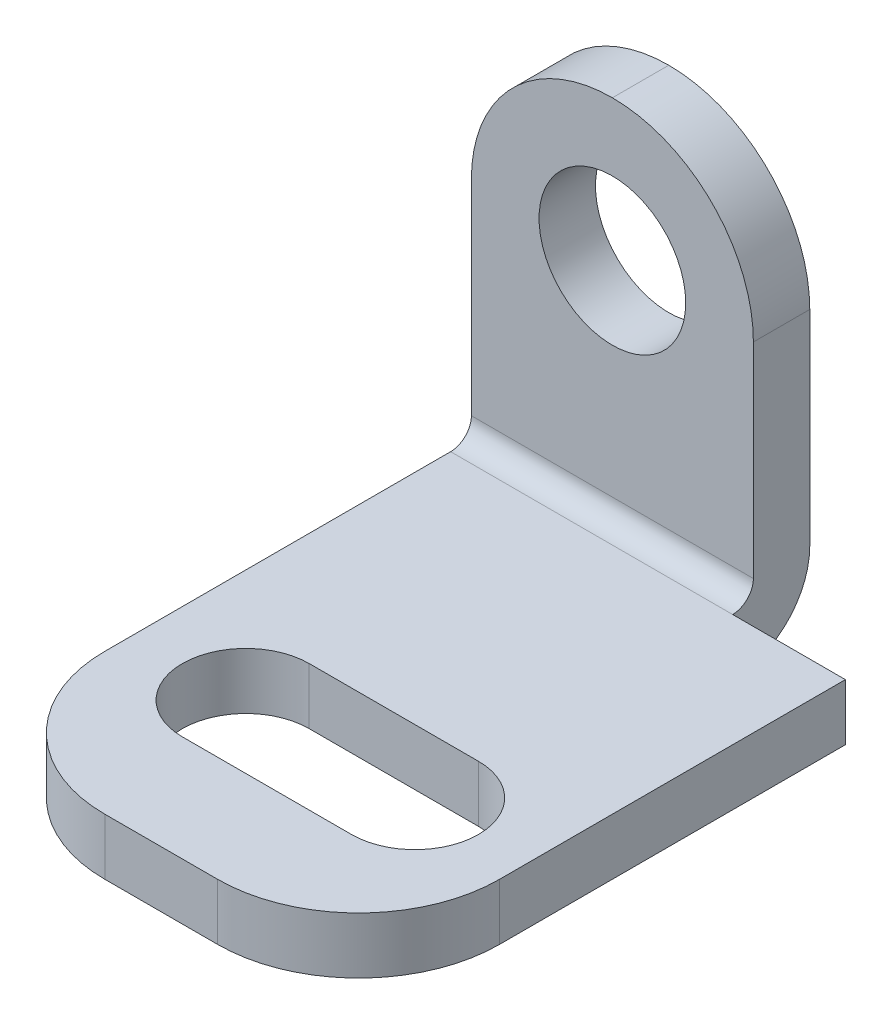
from build123d import *

# Parameters (mm, degrees)
SM_BASE_FLANGE_1_DEPTH = 7
CUT_EXTRUDE_1_DEPTH    = 25.859605789
SKETCH_4_W             = 2.7366
SKETCH_4_H             = 15
CUT_EXTRUDE_2_DEPTH    = 4
FILLET_1_R             = 5
SKETCH_5_R             = 2.6
CUT_EXTRUDE_3_DEPTH    = 25.454038521


# Sheet-metal steps are written as plain solids
with BuildPart() as part:
    # Sketch 1 → 基体-法兰1 (new, symmetric)
    with BuildSketch(Plane(origin=(0, 0, 0), x_dir=(0, 0, -1), z_dir=(1, 0, 0))):
        with BuildLine():
            Line((-20, 0), (-2.7366, 0))
            ThreePointArc((-2.7366, 0), (-0.801531583, 0.801531583), (0, 2.7366))
            Line((0, 2.7366), (0, 15))
            Line((0, 15), (-2, 15))
            Line((-2, 15), (-2, 2.7366))
            ThreePointArc((-2, 2.7366), (-2.215745145, 2.215745145), (-2.7366, 2))
            Line((-2.7366, 2), (-20, 2))
            Line((-20, 2), (-20, 0))
        make_face()
    extrude(amount=SM_BASE_FLANGE_1_DEPTH, both=True)

    # 草图3 → 切除-拉伸1 (cut, through all)
    with BuildSketch(Plane(origin=(0, 2, 0), x_dir=(1, 0, 0), z_dir=(0, 1, 0))):
        with BuildLine():
            Line((-3, -11.75), (3, -11.75))
            ThreePointArc((3, -11.75), (5.25, -14), (3, -16.25))
            Line((3, -16.25), (-3, -16.25))
            ThreePointArc((-3, -16.25), (-5.25, -14), (-3, -11.75))
        make_face()
    extrude(amount=-CUT_EXTRUDE_1_DEPTH, mode=Mode.SUBTRACT)

    # 草图4 → 切除-拉伸2 (cut)
    with BuildSketch(Plane.ZY.offset(-7)):
        with Locations((1.3683, 7.5)):
            Rectangle(SKETCH_4_W, SKETCH_4_H)
    extrude(amount=CUT_EXTRUDE_2_DEPTH, mode=Mode.SUBTRACT)

    # 圆角1
    fillet_1_edges = [part.edges().sort_by_distance(p)[0] for p in [
        (-7, 1, 20),
        (7, 1, 20),
        (3, 15, 1),
        (-7, 15, 1),
    ]]
    fillet(fillet_1_edges, radius=FILLET_1_R - 0.0001)  # a hair under: the kernel refuses the full size

    # 草图5 → 切除-拉伸3 (cut, through all)
    with BuildSketch(Plane.XY.offset(2)):
        with Locations((-2, 10)):
            Circle(SKETCH_5_R)
    extrude(amount=-CUT_EXTRUDE_3_DEPTH, mode=Mode.SUBTRACT)


solid = part.part
